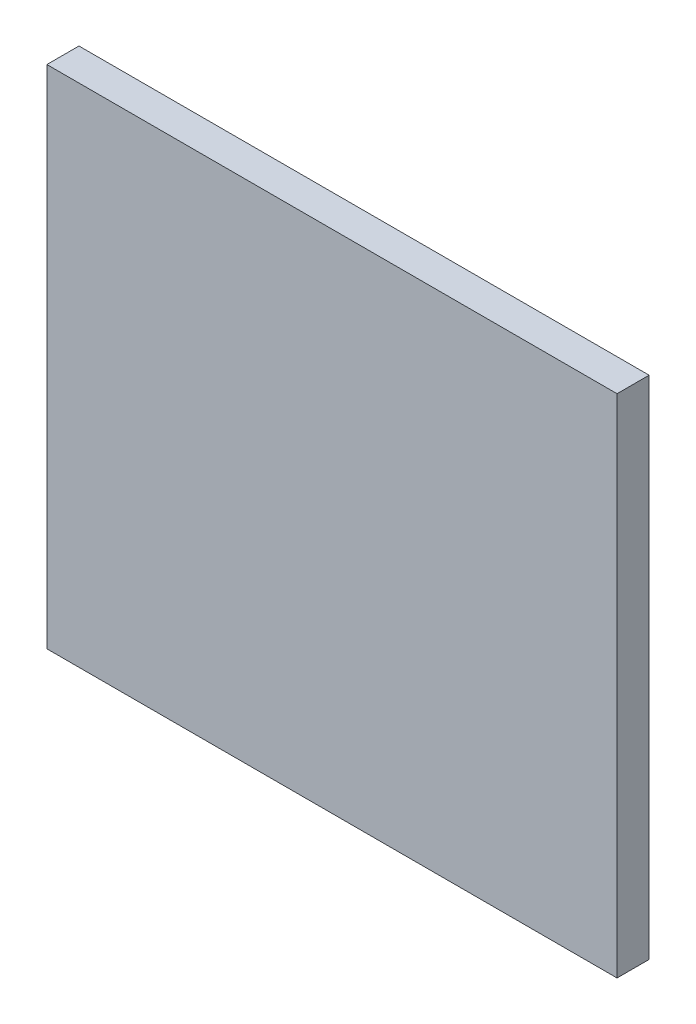
from build123d import *

# Parameters (mm, degrees)
SKETCH1_W           = 80
SKETCH1_H           = 71
BOSS_EXTRUDE1_DEPTH = 4.5


with BuildPart() as part:
    # Sketch1 → Boss-Extrude1 (new body)
    with BuildSketch(Plane.XY):
        Rectangle(SKETCH1_W, SKETCH1_H)
    extrude(amount=BOSS_EXTRUDE1_DEPTH)


solid = part.part
